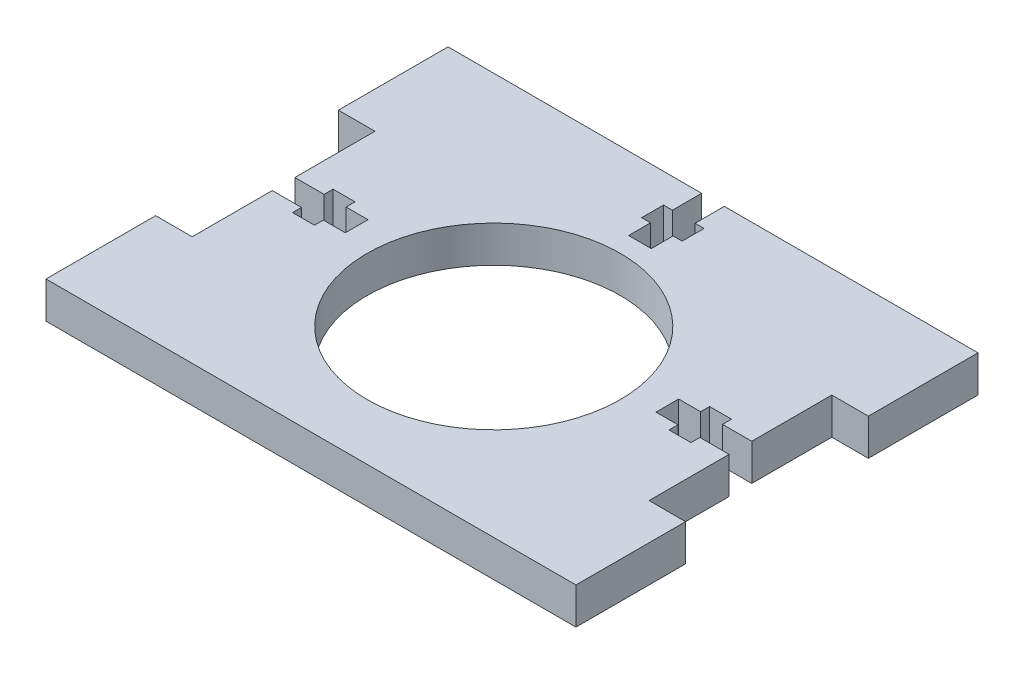
from build123d import *

# Parameters (mm, degrees)
ESQUISSE1_W             = 26.25
ESQUISSE1_H             = 55
BOSS_EXTRU_1_DEPTH      = 5
BOSS_EXTRU_2_DEPTH      = 5
BOSS_EXTRU_3_DEPTH      = 5
ENL_V_MAT_EXTRU_1_DEPTH = 5
ESQUISSE5_W             = 50
ESQUISSE5_H             = 5
BOSS_EXTRU_4_DEPTH      = 36.25
BOSS_EXTRU_5_DEPTH      = 5
BOSS_EXTRU_6_DEPTH      = 5
BOSS_EXTRU_7_DEPTH      = 5
D_GAGEMENT_M301_D       = 34.65
CONG_1_R                = 1.6
ESQUISSE11_W            = 20.033305553
ESQUISSE11_H            = 6.190231364
ESQUISSE11_W_2          = 5
ESQUISSE11_H_2          = 2.95
BOSS_EXTRU_8_DEPTH      = 5
ENL_V_MAT_EXTRU_2_DEPTH = 46.774583559


with BuildPart() as part:
    # Esquisse1 → Boss.-Extru.1 (new body)
    with BuildSketch(Plane(origin=(0, 5, 0), x_dir=(1, 0, 0), z_dir=(0, 1, 0))):
        with Locations((18.125, 0)):
            Rectangle(ESQUISSE1_W, ESQUISSE1_H)
    extrude(amount=-BOSS_EXTRU_1_DEPTH)

    # Esquisse2 → Boss.-Extru.2 (add)
    with BuildSketch(Plane(origin=(31.25, 0, 0), x_dir=(0, 0, -1), z_dir=(1, 0, 0))):
        Polygon((27.5, 5), (27.5, 0), (15.45, 0), (12.5, 2.95), (12.5, 5), align=None)
    extrude(amount=BOSS_EXTRU_2_DEPTH)

    # Esquisse3 → Boss.-Extru.3 (add)
    with BuildSketch(Plane(origin=(31.25, 0, 0), x_dir=(0, 0, -1), z_dir=(1, 0, 0))):
        Polygon((-15.45, 0), (-27.5, 0), (-27.5, 5), (-12.5, 5), (-12.5, 2.95), align=None)
    extrude(amount=BOSS_EXTRU_3_DEPTH)

    # Esquisse4 → Enlèv. mat.-Extru.1 (cut)
    with BuildSketch(Plane(origin=(0, 0, -27.5), x_dir=(-1, 0, 0), z_dir=(0, 0, -1))):
        Polygon((-5, 0), (-5, 2.95), (-7.95, 0), align=None)
    extrude(amount=-ENL_V_MAT_EXTRU_1_DEPTH, mode=Mode.SUBTRACT)

    # Esquisse5 → Boss.-Extru.4 (add)
    with BuildSketch(Plane.ZY.offset(-5)):
        with Locations((2.5, 2.5)):
            Rectangle(ESQUISSE5_W, ESQUISSE5_H)
    extrude(amount=BOSS_EXTRU_4_DEPTH)

    # Esquisse6 → Boss.-Extru.5 (add)
    with BuildSketch(Plane.ZY.offset(31.25)):
        Polygon((27.5, 5), (27.5, 0), (15.45, 0), (12.5, 2.95), (12.5, 5), align=None)
    extrude(amount=BOSS_EXTRU_5_DEPTH)

    # Esquisse7 → Boss.-Extru.6 (add)
    with BuildSketch(Plane.ZY.offset(31.25)):
        Polygon((-22.5, 5), (-12.5, 5), (-12.5, 2.95), (-15.45, 0), (-22.5, 0), align=None)
    extrude(amount=BOSS_EXTRU_6_DEPTH)

    # Esquisse8 → Boss.-Extru.7 (add)
    with BuildSketch(Plane(origin=(0, 0, -22.5), x_dir=(-1, 0, 0), z_dir=(0, 0, -1))):
        Polygon((5, 2.95), (5, 5), (36.25, 5), (36.25, 0), (7.95, 0), align=None)
    extrude(amount=BOSS_EXTRU_7_DEPTH)

    # Dégagement M301 (through all)
    with Locations(Plane(origin=(0, 5, 0), x_dir=(1, 0, 0), z_dir=(0, 1, 0))):
        with Locations((0, -2.5)):
            Hole(D_GAGEMENT_M301_D / 2)

    # Congé1
    cong_1_edges = [part.edges().sort_by_distance(p)[0] for p in [
        (-33.75, 2.95, 12.5),
        (-5, 2.95, -25),
        (-33.75, 2.95, -12.5),
        (33.75, 2.95, -12.5),
        (5, 2.95, -25),
        (33.75, 2.95, 12.5),
    ]]
    fillet(cong_1_edges, radius=CONG_1_R)

    # Esquisse11 → Boss.-Extru.8 (add)
    with BuildSketch(Plane.XZ):
        with Locations((0.06715792, -24.404884318)):
            Rectangle(ESQUISSE11_W, ESQUISSE11_H)
        with Locations((-33.75, -13.975)):
            Rectangle(ESQUISSE11_W_2, ESQUISSE11_H_2)
        with Locations((-33.75, 13.975)):
            Rectangle(ESQUISSE11_W_2, ESQUISSE11_H_2)
        with Locations((33.75, 13.975)):
            Rectangle(ESQUISSE11_W_2, ESQUISSE11_H_2)
        with Locations((33.75, -13.975)):
            Rectangle(ESQUISSE11_W_2, ESQUISSE11_H_2)
    extrude(amount=-BOSS_EXTRU_8_DEPTH)

    # Esquisse12 → Enlèv. mat.-Extru.2 (cut, through all)
    with BuildSketch(Plane.XZ):
        Polygon((-1.55, -27.5), (1.55, -27.5), (1.55, -23.5), (2.78, -23.5), (2.78, -20.5), (1.55, -20.5), (1.55, -17.5), (-1.55, -17.5), (-1.55, -20.5), (-2.77, -20.5), (-2.77, -23.5), (-1.55, -23.5), align=None)
        Polygon((27.25, -1.55), (31.25, -1.55), (31.25, 1.55), (27.25, 1.55), (27.25, 2.77), (24.25, 2.77), (24.25, 1.55), (21.25, 1.55), (21.25, -1.55), (24.25, -1.55), (24.25, -2.78), (27.25, -2.78), align=None)
        Polygon((-27.25, -2.78), (-24.25, -2.78), (-24.25, -1.55), (-21.25, -1.55), (-21.25, 1.55), (-24.25, 1.55), (-24.25, 2.77), (-27.25, 2.77), (-27.25, 1.55), (-31.25, 1.55), (-31.25, -1.55), (-27.25, -1.55), align=None)
    extrude(amount=-ENL_V_MAT_EXTRU_2_DEPTH, mode=Mode.SUBTRACT)


solid = part.part
